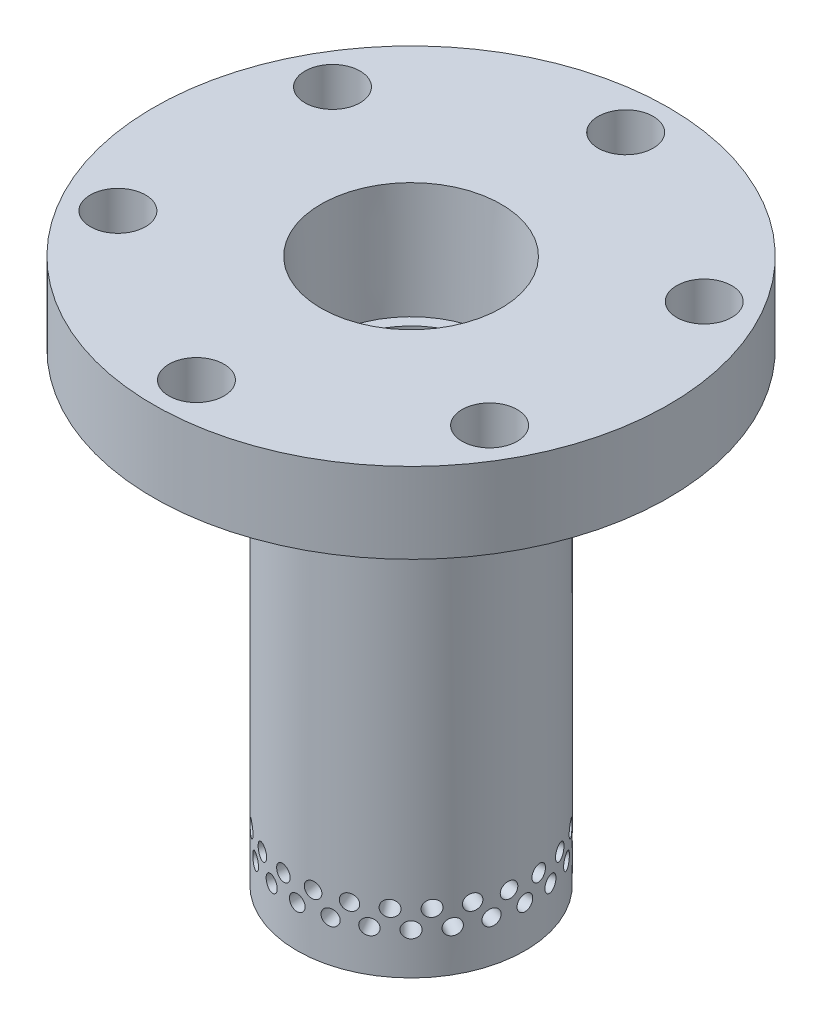
from build123d import *

# Parameters (mm, degrees)
F_1_4_CLEARANCE_HOLE1_D     = 6.5278
F_1_4_CLEARANCE_HOLE1_DEPTH = 22.606
F_1_4_CLEARANCE_HOLE1_TIP   = 1.961148974
CHAMFER1_SIZE               = 1
CHAMFER2_SIZE               = 5.08
CHAMFER2_SIZE2              = 8.45453977
SKETCH6_R                   = 0.9271
CUT_EXTRUDE_49_DEPTH        = 82.803339938
CIRPATTERN1_COUNT           = 24
SKETCH7_R                   = 0.9271
CUT_EXTRUDE_49_2_DEPTH      = 82.803339938
CIRPATTERN2_COUNT           = 24


# Read off the part's stored shape, not the designer's step: CHANGE-LENGTH
with BuildPart() as part:
    # Sketch1 → Revolve1 (revolve)
    with BuildSketch(Plane.XY, mode=Mode.PRIVATE) as revolve1_sk:
        Polygon((0, 0), (-30.48, 0), (-30.48, -9.525), (-21, -9.525), (-21, -7.775), (-18, -7.775), (-18, -9.525), (-13.5, -9.525), (-13.5, -84.525), (0, -84.525), align=None)
    revolve(revolve1_sk.sketch.rotate(Axis((0, 0, 0), (0, 1, 0)), 270), axis=Axis((0, 0, 0), (0, 1, 0)))

    # Sketch3 → 1/2 NPT Tapped Hole1 (revolve, cut)
    with BuildSketch(Plane(origin=(0, 0, 0), x_dir=(0, 0, 1), z_dir=(1, 0, 0))):
        Polygon((0, 0), (0, 81.310543693), (8.9281, 75.946), (8.9281, 13.462), (10.261665792, 13.462), (10.6647361, 0), align=None)
    revolve(axis=Axis((0, 6.35, 0), (0, -1, 0)), mode=Mode.SUBTRACT)

    # 1/4 Clearance Hole1
    with Locations(Plane(origin=(0, 0, 0), x_dir=(1, 0, 0), z_dir=(0, 1, 0))):
        with Locations((21.997045256, 12.7), (0, 25.4), (-21.997045256, 12.7), (-21.997045256, -12.7), (0, -25.4), (21.997045256, -12.7)):
            Hole(F_1_4_CLEARANCE_HOLE1_D / 2, depth=F_1_4_CLEARANCE_HOLE1_DEPTH)
            with Locations((0, 0, -(F_1_4_CLEARANCE_HOLE1_DEPTH + F_1_4_CLEARANCE_HOLE1_TIP / 2))):  # 118° drill point
                Cone(0, F_1_4_CLEARANCE_HOLE1_D / 2, F_1_4_CLEARANCE_HOLE1_TIP, mode=Mode.SUBTRACT)

    # Chamfer1
    chamfer1_edges = [part.edges().sort_by_distance(p)[0] for p in [
        (0, -9.525, 13.5),
    ]]
    chamfer(chamfer1_edges, length=CHAMFER1_SIZE)

    # CHANGE-LENGTH outline → CHANGE-LENGTH (revolve, cut)
    with BuildSketch(Plane.XY):
        Polygon((13.5, -69.525), (8.9281, -69.525), (8.9281, -75.946), (0, -81.310543693), (0, -84.525), (13.5, -84.525), align=None)
    revolve(axis=Axis((0, 0, 0), (0, 1, 0)), mode=Mode.SUBTRACT)

    # CHANGE-LENGTH 2 outline → CHANGE-LENGTH 2 (revolve)
    with BuildSketch(Plane.XY):
        Polygon((0, -66.310543693), (0, -69.525), (8.9281, -69.525), (8.9281, -60.946), align=None)
    revolve(axis=Axis((0, 0, 0), (0, 1, 0)))

    # Chamfer2
    chamfer2_edges = [part.edges().sort_by_distance(p)[0] for p in [
        (0, -69.525, 13.5),
    ]]
    chamfer2_side = [part.faces().sort_by_distance(p)[0] for p in [
        (0, -40.025, 13.5),
    ]]
    chamfer(chamfer2_edges, length=CHAMFER2_SIZE, length2=CHAMFER2_SIZE2, reference=chamfer2_side[0])

    # Sketch6 → #49 (cut, through all)
    with BuildSketch(Plane.XY):
        with Locations((0, -59.5109)):
            Circle(SKETCH6_R)
    cut_extrude_49 = extrude(amount=-CUT_EXTRUDE_49_DEPTH, mode=Mode.SUBTRACT)

    # CirPattern1: #49 ×24 about axis
    cirpattern1_axis = Axis((0, 0, 0), (0, -1, 0))
    for i in range(1, CIRPATTERN1_COUNT):
        add(cut_extrude_49.rotate(cirpattern1_axis, i * 360 / CIRPATTERN1_COUNT), mode=Mode.SUBTRACT)

    # Sketch7 → #49-2 (cut, through all)
    with BuildSketch(Plane(origin=(0, 0, 0), x_dir=(0, -1, 0), z_dir=(0.9914448613738104, 0, 0.13052619222005188))):
        with Locations(Location((57.39, 0, 0), (0, 0, 90))):
            Circle(SKETCH7_R)
    cut_extrude_49_2 = extrude(amount=-CUT_EXTRUDE_49_2_DEPTH, mode=Mode.SUBTRACT)

    # CirPattern2: #49-2 ×24 about axis
    cirpattern2_axis = Axis((0, 0, 0), (0, -1, 0))
    for i in range(1, CIRPATTERN2_COUNT):
        add(cut_extrude_49_2.rotate(cirpattern2_axis, i * 360 / CIRPATTERN2_COUNT), mode=Mode.SUBTRACT)


solid = part.part
